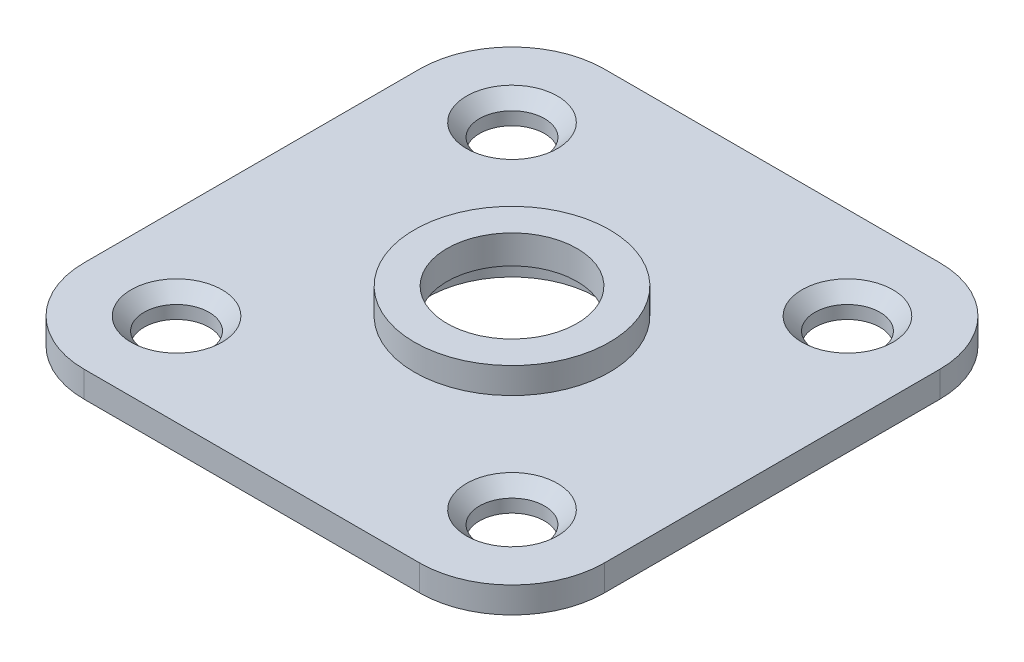
from build123d import *

# Parameters (mm, degrees)
SKETCH2_W               = 50.8
SKETCH2_H               = 50.8
BASE_FLANGE1_DEPTH      = 2.54
FILLET1_R               = 9.017
SKETCH9_R               = 9.525
BOSS_EXTRUDE1_DEPTH     = 2.54
SKETCH10_R              = 8.255
CUT_EXTRUDE1_DEPTH      = 2.286
SKETCH11_R              = 6.35
CUT_EXTRUDE2_DEPTH      = 37.029521729
SKETCH12_R              = 3.175
CUT_EXTRUDE4_DEPTH      = 37.278456417
MIRROR2_COPY_1_SKETCH_R = 3.175
MIRROR2_COPY_1_DEPTH    = 37.278456417
CHAMFER1_SIZE           = 1.27


# Sheet-metal steps are written as plain solids
with BuildPart() as part:
    # Sketch2 → Base-Flange1 (new body)
    with BuildSketch(Plane(origin=(0, 0, 0), x_dir=(1, 0, 0), z_dir=(0, 1, 0))):
        Rectangle(SKETCH2_W, SKETCH2_H)
    extrude(amount=-BASE_FLANGE1_DEPTH)

    # Fillet1
    fillet1_edges = [part.edges().sort_by_distance(p)[0] for p in [
        (25.4, -1.27, 25.4),
        (-25.4, -1.27, 25.4),
        (-25.4, -1.27, -25.4),
        (25.4, -1.27, -25.4),
    ]]
    fillet(fillet1_edges, radius=FILLET1_R)

    # Sketch9 → Boss-Extrude1 (add)
    with BuildSketch(Plane(origin=(0, 0, 0), x_dir=(1, 0, 0), z_dir=(0, 1, 0))):
        with Locations(Location((0, 0, 0), (0, 0, 270))):
            Circle(SKETCH9_R)
    extrude(amount=BOSS_EXTRUDE1_DEPTH)

    # Sketch10 → Cut-Extrude1 (cut)
    with BuildSketch(Plane.XZ.offset(2.54)):
        with Locations(Location((0, 0, 0), (0, 0, 270))):
            Circle(SKETCH10_R)
    extrude(amount=-CUT_EXTRUDE1_DEPTH, mode=Mode.SUBTRACT)

    # Sketch11 → Cut-Extrude2 (cut, through all)
    with BuildSketch(Plane.XZ.offset(0.254)):
        with Locations(Location((0, 0, 0), (0, 0, 270))):
            Circle(SKETCH11_R)
    extrude(amount=-CUT_EXTRUDE2_DEPTH, mode=Mode.SUBTRACT)

    # Sketch12 → Cut-Extrude4 (cut, through all)
    with BuildSketch(Plane.XZ.offset(2.54)):
        with Locations(Location((-16.383, -16.383, 0), (0, 0, 270))):
            Circle(SKETCH12_R)
    cut_extrude4 = extrude(amount=-CUT_EXTRUDE4_DEPTH, mode=Mode.SUBTRACT)

    # Mirror1: Cut-Extrude4 across plane
    add(cut_extrude4.mirror(Plane(origin=(0, 0, 0), x_dir=(0, 0, 1), z_dir=(1, 0, 0))), mode=Mode.SUBTRACT)

    # Mirror2: Cut-Extrude4 across plane
    add(cut_extrude4.mirror(Plane.XY), mode=Mode.SUBTRACT)

    # Mirror2 copy 1 sketch → Mirror2 copy 1 (cut, through all)
    with BuildSketch(Plane(origin=(0, -2.54, 0), x_dir=(-1, 0, 0), z_dir=(0, -1, 0))):
        with Locations(Location((-16.383, -16.383, 0), (0, 0, 270))):
            Circle(MIRROR2_COPY_1_SKETCH_R)
    extrude(amount=-MIRROR2_COPY_1_DEPTH, mode=Mode.SUBTRACT)

    # Chamfer1
    chamfer1_edges = [part.edges().sort_by_distance(p)[0] for p in [
        (-16.383, 0, -13.208),
        (16.383, 0, -13.208),
        (16.383, 0, 13.208),
        (-16.383, 0, 13.208),
    ]]
    chamfer(chamfer1_edges, length=CHAMFER1_SIZE)


solid = part.part
